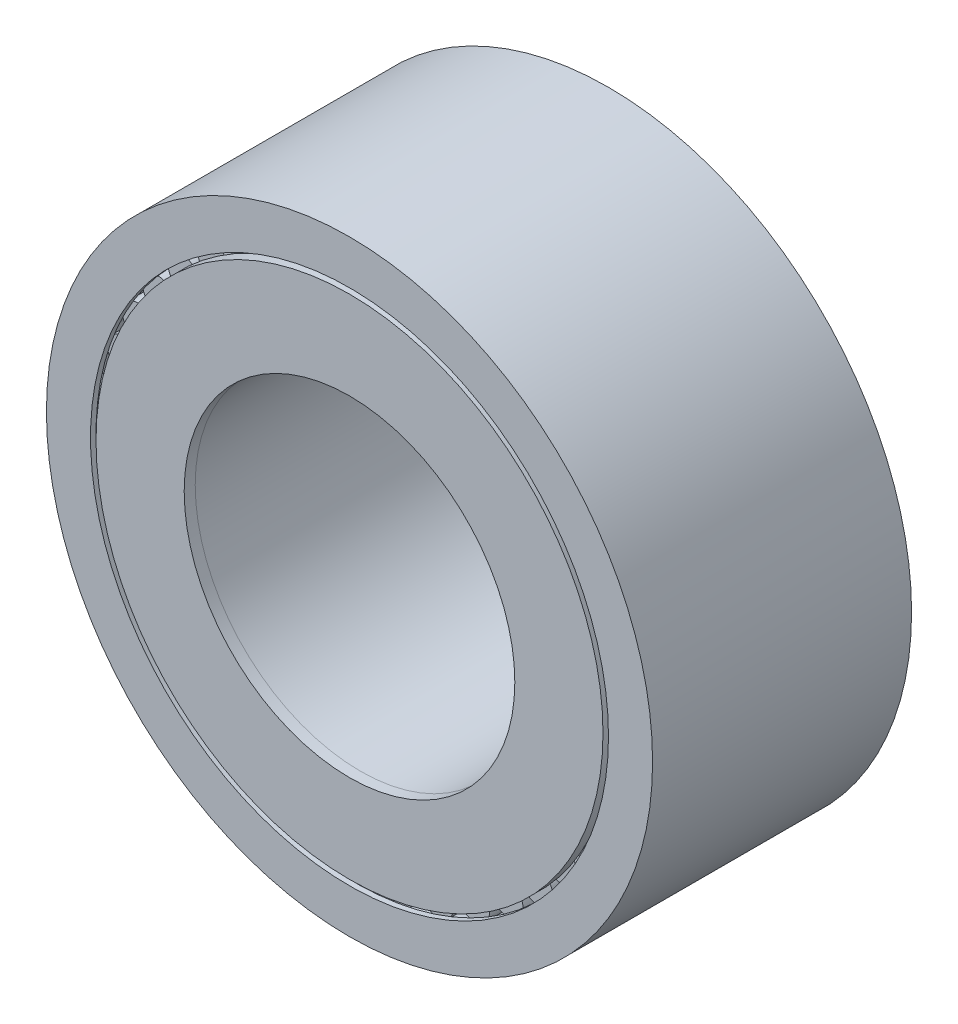
from build123d import *
from build123d.topology import SkipClean

# Parameters (mm, degrees)
CROQUIS1_R               = 22
CROQUIS1_R_2             = 15
SALIENTE_EXTRUIR1_DEPTH  = 20
CROQUIS2_R               = 1.45
CORTAR_EXTRUIR1_DEPTH    = 23
MATRIZC1_COUNT           = 40
CROQUIS3_R               = 1.4
SALIENTE_EXTRUIR2_DEPTH  = 20
MATRIZC4_COUNT           = 40
CROQUIS4_R               = 27.5
CROQUIS4_R_2             = 24.1
SALIENTE_EXTRUIR3_DEPTH  = 20
SALIENTE_EXTRUIR4_START  = 3.5
CROQUIS5_R               = 23
CROQUIS5_R_2             = 15
SALIENTE_EXTRUIR4_DEPTH  = 3.5
CROQUIS6_R               = 27.5
CROQUIS6_R_2             = 24.1
SALIENTE_EXTRUIR7_DEPTH  = 1
CROQUIS7_R               = 27.5
CROQUIS7_R_2             = 23.5
SALIENTE_EXTRUIR8_DEPTH  = 2.5
CROQUIS8_R               = 1.4
CORTAR_EXTRUIR2_DEPTH    = 1
MATRIZC5_COUNT           = 40
CROQUIS9_R               = 24.1
CROQUIS9_R_2             = 23.5
SALIENTE_EXTRUIR10_DEPTH = 0.5
CROQUIS10_R              = 23
CROQUIS10_R_2            = 15
SALIENTE_EXTRUIR11_DEPTH = 1
CROQUIS11_R              = 22.402673988
CORTAR_EXTRUIR3_DEPTH    = 1
SALIENTE_EXTRUIR12_START = 1
CROQUIS12_R              = 23
CROQUIS12_R_2            = 4
CROQUIS12_R_3            = 3.8
SALIENTE_EXTRUIR12_DEPTH = 1
CHAFL_N1_SIZE            = 1
CHAFL_N2_SIZE            = 1


# Some blends are built 0.0001 mm under size
with BuildPart() as part:
    # Croquis1 → Saliente-Extruir1 (new body)
    with BuildSketch(Plane.XY):
        Circle(CROQUIS1_R)
        Circle(CROQUIS1_R_2, mode=Mode.SUBTRACT)
    extrude(amount=SALIENTE_EXTRUIR1_DEPTH)

    # Croquis2 → Cortar-Extruir1 (cut)
    with BuildSketch(Plane.XY.offset(20)):
        with Locations((0, 22.7)):
            Circle(CROQUIS2_R)
    cortar_extruir1 = extrude(amount=-CORTAR_EXTRUIR1_DEPTH, mode=Mode.SUBTRACT)

    # MatrizC1: Cortar-Extruir1 ×40 about axis
    matrizc1_axis = Axis((0, 0, 0), (0, 0, 1))
    for i in range(1, MATRIZC1_COUNT):
        add(cortar_extruir1.rotate(matrizc1_axis, i * 360 / MATRIZC1_COUNT), mode=Mode.SUBTRACT)



with BuildPart() as body_2:
    # Croquis3 → Saliente-Extruir2 (new body)
    with BuildSketch(Plane.XY.offset(20)):
        with Locations((-10.305584344, 20.225848099)):
            Circle(CROQUIS3_R)
    extrude(amount=-SALIENTE_EXTRUIR2_DEPTH)


with BuildPart() as matrizc4_1:
    # MatrizC4: pattern copy
    add(body_2.part.rotate(Axis((0, 0, 0), (0, 0, 1)), 1 * 360 / MATRIZC4_COUNT))


with BuildPart() as matrizc4_2:
    # MatrizC4: pattern copy
    add(body_2.part.rotate(Axis((0, 0, 0), (0, 0, 1)), 2 * 360 / MATRIZC4_COUNT))


with BuildPart() as matrizc4_3:
    # MatrizC4: pattern copy
    add(body_2.part.rotate(Axis((0, 0, 0), (0, 0, 1)), 3 * 360 / MATRIZC4_COUNT))


with BuildPart() as matrizc4_4:
    # MatrizC4: pattern copy
    add(body_2.part.rotate(Axis((0, 0, 0), (0, 0, 1)), 4 * 360 / MATRIZC4_COUNT))


with BuildPart() as matrizc4_5:
    # MatrizC4: pattern copy
    add(body_2.part.rotate(Axis((0, 0, 0), (0, 0, 1)), 5 * 360 / MATRIZC4_COUNT))


with BuildPart() as matrizc4_6:
    # MatrizC4: pattern copy
    add(body_2.part.rotate(Axis((0, 0, 0), (0, 0, 1)), 6 * 360 / MATRIZC4_COUNT))


with BuildPart() as matrizc4_7:
    # MatrizC4: pattern copy
    add(body_2.part.rotate(Axis((0, 0, 0), (0, 0, 1)), 7 * 360 / MATRIZC4_COUNT))


with BuildPart() as matrizc4_8:
    # MatrizC4: pattern copy
    add(body_2.part.rotate(Axis((0, 0, 0), (0, 0, 1)), 8 * 360 / MATRIZC4_COUNT))


with BuildPart() as matrizc4_9:
    # MatrizC4: pattern copy
    add(body_2.part.rotate(Axis((0, 0, 0), (0, 0, 1)), 9 * 360 / MATRIZC4_COUNT))


with BuildPart() as matrizc4_10:
    # MatrizC4: pattern copy
    add(body_2.part.rotate(Axis((0, 0, 0), (0, 0, 1)), 10 * 360 / MATRIZC4_COUNT))


with BuildPart() as matrizc4_11:
    # MatrizC4: pattern copy
    add(body_2.part.rotate(Axis((0, 0, 0), (0, 0, 1)), 11 * 360 / MATRIZC4_COUNT))


with BuildPart() as matrizc4_12:
    # MatrizC4: pattern copy
    add(body_2.part.rotate(Axis((0, 0, 0), (0, 0, 1)), 12 * 360 / MATRIZC4_COUNT))


with BuildPart() as matrizc4_13:
    # MatrizC4: pattern copy
    add(body_2.part.rotate(Axis((0, 0, 0), (0, 0, 1)), 13 * 360 / MATRIZC4_COUNT))


with BuildPart() as matrizc4_14:
    # MatrizC4: pattern copy
    add(body_2.part.rotate(Axis((0, 0, 0), (0, 0, 1)), 14 * 360 / MATRIZC4_COUNT))


with BuildPart() as matrizc4_15:
    # MatrizC4: pattern copy
    add(body_2.part.rotate(Axis((0, 0, 0), (0, 0, 1)), 15 * 360 / MATRIZC4_COUNT))


with BuildPart() as matrizc4_16:
    # MatrizC4: pattern copy
    add(body_2.part.rotate(Axis((0, 0, 0), (0, 0, 1)), 16 * 360 / MATRIZC4_COUNT))


with BuildPart() as matrizc4_17:
    # MatrizC4: pattern copy
    add(body_2.part.rotate(Axis((0, 0, 0), (0, 0, 1)), 17 * 360 / MATRIZC4_COUNT))


with BuildPart() as matrizc4_18:
    # MatrizC4: pattern copy
    add(body_2.part.rotate(Axis((0, 0, 0), (0, 0, 1)), 18 * 360 / MATRIZC4_COUNT))


with BuildPart() as matrizc4_19:
    # MatrizC4: pattern copy
    add(body_2.part.rotate(Axis((0, 0, 0), (0, 0, 1)), 19 * 360 / MATRIZC4_COUNT))


with BuildPart() as matrizc4_20:
    # MatrizC4: pattern copy
    add(body_2.part.rotate(Axis((0, 0, 0), (0, 0, 1)), 20 * 360 / MATRIZC4_COUNT))


with BuildPart() as matrizc4_21:
    # MatrizC4: pattern copy
    add(body_2.part.rotate(Axis((0, 0, 0), (0, 0, 1)), 21 * 360 / MATRIZC4_COUNT))


with BuildPart() as matrizc4_22:
    # MatrizC4: pattern copy
    add(body_2.part.rotate(Axis((0, 0, 0), (0, 0, 1)), 22 * 360 / MATRIZC4_COUNT))


with BuildPart() as matrizc4_23:
    # MatrizC4: pattern copy
    add(body_2.part.rotate(Axis((0, 0, 0), (0, 0, 1)), 23 * 360 / MATRIZC4_COUNT))


with BuildPart() as matrizc4_24:
    # MatrizC4: pattern copy
    add(body_2.part.rotate(Axis((0, 0, 0), (0, 0, 1)), 24 * 360 / MATRIZC4_COUNT))


with BuildPart() as matrizc4_25:
    # MatrizC4: pattern copy
    add(body_2.part.rotate(Axis((0, 0, 0), (0, 0, 1)), 25 * 360 / MATRIZC4_COUNT))


with BuildPart() as matrizc4_26:
    # MatrizC4: pattern copy
    add(body_2.part.rotate(Axis((0, 0, 0), (0, 0, 1)), 26 * 360 / MATRIZC4_COUNT))


with BuildPart() as matrizc4_27:
    # MatrizC4: pattern copy
    add(body_2.part.rotate(Axis((0, 0, 0), (0, 0, 1)), 27 * 360 / MATRIZC4_COUNT))


with BuildPart() as matrizc4_28:
    # MatrizC4: pattern copy
    add(body_2.part.rotate(Axis((0, 0, 0), (0, 0, 1)), 28 * 360 / MATRIZC4_COUNT))


with BuildPart() as matrizc4_29:
    # MatrizC4: pattern copy
    add(body_2.part.rotate(Axis((0, 0, 0), (0, 0, 1)), 29 * 360 / MATRIZC4_COUNT))


with BuildPart() as matrizc4_30:
    # MatrizC4: pattern copy
    add(body_2.part.rotate(Axis((0, 0, 0), (0, 0, 1)), 30 * 360 / MATRIZC4_COUNT))


with BuildPart() as matrizc4_31:
    # MatrizC4: pattern copy
    add(body_2.part.rotate(Axis((0, 0, 0), (0, 0, 1)), 31 * 360 / MATRIZC4_COUNT))


with BuildPart() as matrizc4_32:
    # MatrizC4: pattern copy
    add(body_2.part.rotate(Axis((0, 0, 0), (0, 0, 1)), 32 * 360 / MATRIZC4_COUNT))


with BuildPart() as matrizc4_33:
    # MatrizC4: pattern copy
    add(body_2.part.rotate(Axis((0, 0, 0), (0, 0, 1)), 33 * 360 / MATRIZC4_COUNT))


with BuildPart() as matrizc4_34:
    # MatrizC4: pattern copy
    add(body_2.part.rotate(Axis((0, 0, 0), (0, 0, 1)), 34 * 360 / MATRIZC4_COUNT))


with BuildPart() as matrizc4_35:
    # MatrizC4: pattern copy
    add(body_2.part.rotate(Axis((0, 0, 0), (0, 0, 1)), 35 * 360 / MATRIZC4_COUNT))


with BuildPart() as matrizc4_36:
    # MatrizC4: pattern copy
    add(body_2.part.rotate(Axis((0, 0, 0), (0, 0, 1)), 36 * 360 / MATRIZC4_COUNT))


with BuildPart() as matrizc4_37:
    # MatrizC4: pattern copy
    add(body_2.part.rotate(Axis((0, 0, 0), (0, 0, 1)), 37 * 360 / MATRIZC4_COUNT))


with BuildPart() as matrizc4_38:
    # MatrizC4: pattern copy
    add(body_2.part.rotate(Axis((0, 0, 0), (0, 0, 1)), 38 * 360 / MATRIZC4_COUNT))


with BuildPart() as matrizc4_39:
    # MatrizC4: pattern copy
    add(body_2.part.rotate(Axis((0, 0, 0), (0, 0, 1)), 39 * 360 / MATRIZC4_COUNT))


with BuildPart() as body_42:
    # Croquis4 → Saliente-Extruir3 (new body)
    with BuildSketch(Plane.XY.offset(20)):
        Circle(CROQUIS4_R)
        Circle(CROQUIS4_R_2, mode=Mode.SUBTRACT)
    extrude(amount=-SALIENTE_EXTRUIR3_DEPTH)

    # Croquis6 → Saliente-Extruir7 (add)
    with BuildSketch(Plane(origin=(0, 0, 0), x_dir=(-1, 0, 0), z_dir=(0, 0, -1))):
        with Locations(Location((0, 0, 0), (0, 0, 180))):
            Circle(CROQUIS6_R)
        with Locations(Location((0, 0, 0), (0, 0, 180))):
            Circle(CROQUIS6_R_2, mode=Mode.SUBTRACT)
    extrude(amount=SALIENTE_EXTRUIR7_DEPTH)

    # Croquis7 → Saliente-Extruir8 (add)
    with BuildSketch(Plane(origin=(0, 0, -1), x_dir=(-1, 0, 0), z_dir=(0, 0, -1))):
        with Locations(Location((0, 0, 0), (0, 0, 180))):
            Circle(CROQUIS7_R)
        Circle(CROQUIS7_R_2, mode=Mode.SUBTRACT)
    extrude(amount=SALIENTE_EXTRUIR8_DEPTH)

    # Croquis9 → Saliente-Extruir10 (add)
    with BuildSketch(Plane.XY.offset(20)):
        Circle(CROQUIS9_R)
        with Locations(Location((0, 0, 0), (0, 0, 180))):
            Circle(CROQUIS9_R_2, mode=Mode.SUBTRACT)
    extrude(amount=-SALIENTE_EXTRUIR10_DEPTH)


with BuildPart() as part_1:
    with SkipClean():  # the faces are left unmerged after this step: merging them gives an invalid solid
        add(part.part)

        add(body_2.part)  # Saliente-Extruir4 merges body 2

        add(matrizc4_1.part)  # Saliente-Extruir4 merges MatrizC4_1

        add(matrizc4_2.part)  # Saliente-Extruir4 merges MatrizC4_2

        add(matrizc4_3.part)  # Saliente-Extruir4 merges MatrizC4_3

        add(matrizc4_4.part)  # Saliente-Extruir4 merges MatrizC4_4

        add(matrizc4_5.part)  # Saliente-Extruir4 merges MatrizC4_5

        add(matrizc4_6.part)  # Saliente-Extruir4 merges MatrizC4_6

        add(matrizc4_7.part)  # Saliente-Extruir4 merges MatrizC4_7

        add(matrizc4_8.part)  # Saliente-Extruir4 merges MatrizC4_8

        add(matrizc4_9.part)  # Saliente-Extruir4 merges MatrizC4_9

        add(matrizc4_10.part)  # Saliente-Extruir4 merges MatrizC4_10

        add(matrizc4_11.part)  # Saliente-Extruir4 merges MatrizC4_11

        add(matrizc4_12.part)  # Saliente-Extruir4 merges MatrizC4_12

        add(matrizc4_13.part)  # Saliente-Extruir4 merges MatrizC4_13

        add(matrizc4_14.part)  # Saliente-Extruir4 merges MatrizC4_14

        add(matrizc4_15.part)  # Saliente-Extruir4 merges MatrizC4_15

        add(matrizc4_16.part)  # Saliente-Extruir4 merges MatrizC4_16

        add(matrizc4_17.part)  # Saliente-Extruir4 merges MatrizC4_17

        add(matrizc4_18.part)  # Saliente-Extruir4 merges MatrizC4_18

        add(matrizc4_19.part)  # Saliente-Extruir4 merges MatrizC4_19

        add(matrizc4_20.part)  # Saliente-Extruir4 merges MatrizC4_20

        add(matrizc4_21.part)  # Saliente-Extruir4 merges MatrizC4_21

        add(matrizc4_22.part)  # Saliente-Extruir4 merges MatrizC4_22

        add(matrizc4_23.part)  # Saliente-Extruir4 merges MatrizC4_23

        add(matrizc4_24.part)  # Saliente-Extruir4 merges MatrizC4_24

        add(matrizc4_25.part)  # Saliente-Extruir4 merges MatrizC4_25

        add(matrizc4_26.part)  # Saliente-Extruir4 merges MatrizC4_26

        add(matrizc4_27.part)  # Saliente-Extruir4 merges MatrizC4_27

        add(matrizc4_28.part)  # Saliente-Extruir4 merges MatrizC4_28

        add(matrizc4_29.part)  # Saliente-Extruir4 merges MatrizC4_29

        add(matrizc4_30.part)  # Saliente-Extruir4 merges MatrizC4_30

        add(matrizc4_31.part)  # Saliente-Extruir4 merges MatrizC4_31

        add(matrizc4_32.part)  # Saliente-Extruir4 merges MatrizC4_32

        add(matrizc4_33.part)  # Saliente-Extruir4 merges MatrizC4_33

        add(matrizc4_34.part)  # Saliente-Extruir4 merges MatrizC4_34

        add(matrizc4_35.part)  # Saliente-Extruir4 merges MatrizC4_35

        add(matrizc4_36.part)  # Saliente-Extruir4 merges MatrizC4_36

        add(matrizc4_37.part)  # Saliente-Extruir4 merges MatrizC4_37

        add(matrizc4_38.part)  # Saliente-Extruir4 merges MatrizC4_38

        add(matrizc4_39.part)  # Saliente-Extruir4 merges MatrizC4_39
        # Croquis5 → Saliente-Extruir4 (add)
        with BuildSketch(Plane(origin=(0, 0, 0), x_dir=(-1, 0, 0), z_dir=(0, 0, -1)).offset(SALIENTE_EXTRUIR4_START)):
            with Locations(Location((0, 0, 0), (0, 0, 183.429504864))):
                Circle(CROQUIS5_R)
            Circle(CROQUIS5_R_2, mode=Mode.SUBTRACT)
        extrude(amount=-SALIENTE_EXTRUIR4_DEPTH)

    # Croquis8 → Cortar-Extruir2 (cut)
    with SkipClean():  # the faces are left unmerged after this step: merging them gives an invalid solid
        with BuildSketch(Plane.XY.offset(20)):
            with Locations((0, 22.7)):
                Circle(CROQUIS8_R)
        cortar_extruir2 = extrude(amount=-CORTAR_EXTRUIR2_DEPTH, mode=Mode.SUBTRACT)

    # MatrizC5: Cortar-Extruir2 ×40 about axis
    with SkipClean():  # the faces are left unmerged after this step: merging them gives an invalid solid
        matrizc5_axis = Axis((0, 0, 20), (0, 0, -1))
        for i in range(1, MATRIZC5_COUNT):
            add(cortar_extruir2.rotate(matrizc5_axis, i * 360 / MATRIZC5_COUNT), mode=Mode.SUBTRACT)

    # Croquis11 → Cortar-Extruir3 (cut)
    with SkipClean():  # the faces are left unmerged after this step: merging them gives an invalid solid
        with BuildSketch(Plane.XY.offset(20)):
            Circle(CROQUIS11_R)
        extrude(amount=-CORTAR_EXTRUIR3_DEPTH, mode=Mode.SUBTRACT)

    # Croquis12 → Saliente-Extruir12 (add)
    with SkipClean():  # the faces are left unmerged after this step: merging them gives an invalid solid
        with BuildSketch(Plane(origin=(0, 0, -3.5), x_dir=(-1, 0, 0), z_dir=(0, 0, -1)).offset(SALIENTE_EXTRUIR12_START)):
            with Locations(Location((0, 0, 0), (0, 0, 180))):
                Circle(CROQUIS12_R)
            with Locations((0, 10)):
                Circle(CROQUIS12_R_2, mode=Mode.SUBTRACT)
            Circle(CROQUIS12_R_3, mode=Mode.SUBTRACT)
            with Locations((9.510565163, 3.090169944)):
                Circle(CROQUIS12_R_2, mode=Mode.SUBTRACT)
            with Locations((5.877852523, -8.090169944)):
                Circle(CROQUIS12_R_2, mode=Mode.SUBTRACT)
            with Locations((-5.877852523, -8.090169944)):
                Circle(CROQUIS12_R_2, mode=Mode.SUBTRACT)
            with Locations((-9.510565163, 3.090169944)):
                Circle(CROQUIS12_R_2, mode=Mode.SUBTRACT)
        extrude(amount=-SALIENTE_EXTRUIR12_DEPTH)

    # Chaflán1
    # the kernel refuses this chamfer: 1 mm, written as the material it takes off along each edge
    with BuildSketch(Plane(origin=(0, 0, -4.5), x_dir=(1, 0, 0), z_dir=(0, 1, 0))) as chafl_n1_piece_1:
        Polygon((23, -CHAFL_N1_SIZE), (23 - CHAFL_N1_SIZE, 0), (23, 0), align=None)
    revolve(axis=Axis((0, 0, -4.5), (0, 0, -1)), mode=Mode.SUBTRACT)

    # Chaflán2
    chafl_n2_edges = [part_1.edges().sort_by_distance(p)[0] for p in [
        (4, 10, -4.5),
        (-5.510565163, 3.090169944, -4.5),
        (-1.877852523, -8.090169944, -4.5),
        (9.877852523, -8.090169944, -4.5),
        (13.510565163, 3.090169944, -4.5),
    ]]
    chamfer(chafl_n2_edges, length=CHAFL_N2_SIZE - 0.0001)  # a hair under: the kernel refuses the full size


with BuildPart() as body_3:
    # Croquis10 → Saliente-Extruir11 (new body)
    with BuildSketch(Plane.XY.offset(20)):
        Circle(CROQUIS10_R)
        Circle(CROQUIS10_R_2, mode=Mode.SUBTRACT)
    extrude(amount=-SALIENTE_EXTRUIR11_DEPTH)


solid = Compound([body_42.part, part_1.part, body_3.part])
